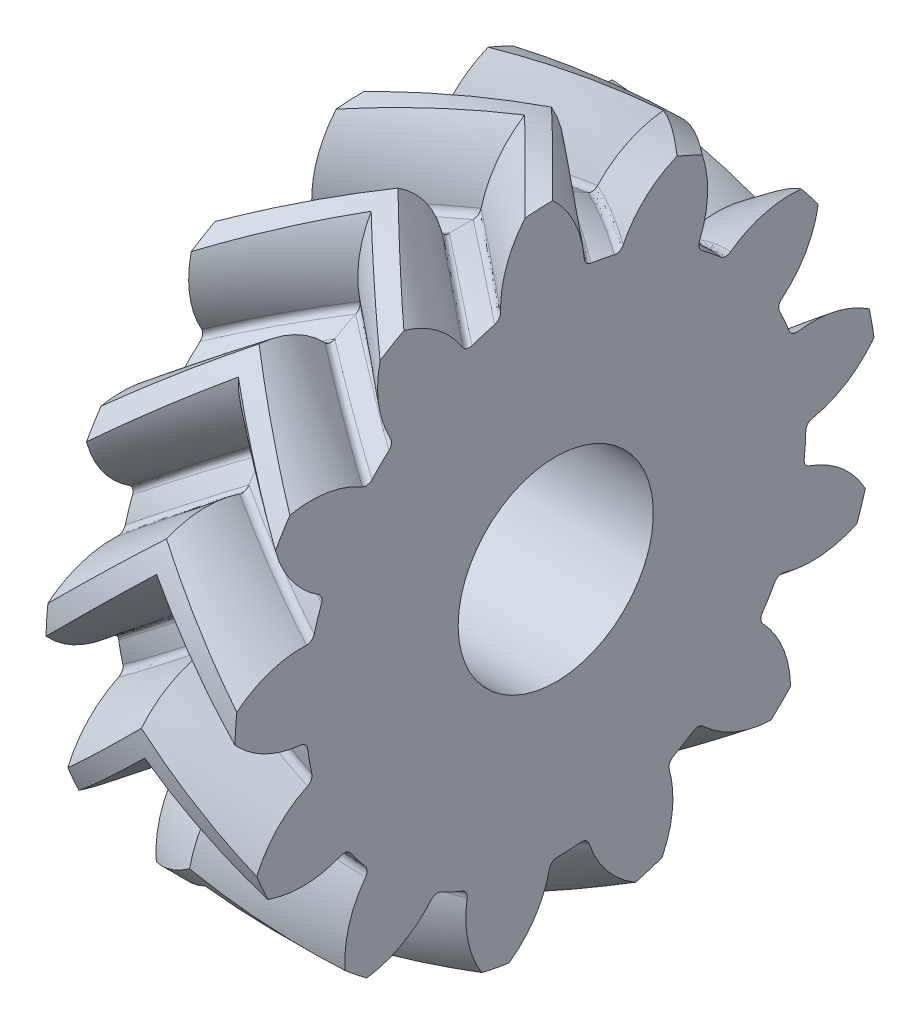
from build123d import *

# Parameters (mm, degrees)
BASPROSKE_W            = 3
BASPROSKE_H            = 10.192388155
TOOTHCUTRH_PITCH       = 64.040663503
TOOTHCUTRH_HEIGHT      = 3
TOOTHCUTRH_RADIUS      = 10.192388155
TOOTHCUTRH_START_ANGLE = -90
TEETHCUTSRH_COUNT      = 13
TEETHCUTSRH_ANGLE      = 332.307692308
BORSKE_R               = 3
BORE_DEPTH             = 62.5000025
SKETCH3_R              = 3.1
CUT_EXTRUDE1_DEPTH     = 16.613121343


with BuildPart() as part:
    # BasProSke → Base-Revolve (revolve)
    with BuildSketch(Plane(origin=(0, 0, 0), x_dir=(1, 0, 0), z_dir=(0, 1, 0)), mode=Mode.PRIVATE) as base_revolve_sk:
        with Locations((1.5, 5.096194078)):
            Rectangle(BASPROSKE_W, BASPROSKE_H)
    revolve(base_revolve_sk.sketch.rotate(Axis((-10, 0, 0), (1, 0, 0)), 180), axis=Axis((-10, 0, 0), (1, 0, 0)))

    # ToothCutRH: sweep along a helix
    with BuildLine() as toothcutrh_path:
        add(Helix(TOOTHCUTRH_PITCH, TOOTHCUTRH_HEIGHT, TOOTHCUTRH_RADIUS, center=(0, 0, 0), direction=(1, 0, 0), mode=Mode.PRIVATE).rotate(Axis((0, 0, 0), (1, 0, 0)), TOOTHCUTRH_START_ANGLE))
    # TooCutSkeRH → ToothCutRH (sweep, cut)
    with BuildSketch(Plane(origin=(0, 0, 0), x_dir=(0, 0, -1), z_dir=(1, 0, 0))):
        with BuildLine():
            ThreePointArc((0.375776511, 7.933493658), (0, 7.942388155), (-0.375776511, 7.933493658))
            ThreePointArc((-0.375776511, 7.933493658), (-0.535012481, 7.981023261), (-0.629656106, 8.117616603))
            ThreePointArc((-0.629656106, 8.117616603), (-1.291728477, 9.365875371), (-2.420945746, 10.215203419))
            ThreePointArc((-2.420945746, 10.215203419), (0, 10.4981598), (2.420945746, 10.215203419))
            ThreePointArc((2.420945746, 10.215203419), (1.291728477, 9.365875371), (0.629656106, 8.117616603))
            ThreePointArc((0.629656106, 8.117616603), (0.535012481, 7.981023261), (0.375776511, 7.933493658))
        make_face()
    toothcutrh = sweep(path=toothcutrh_path.line, is_frenet=True, mode=Mode.SUBTRACT)

    # TeethCutsRH: ToothCutRH ×13 about axis
    teethcutsrh_axis = Axis((-10, 0, 0), (1, 0, 0))
    for i in range(1, TEETHCUTSRH_COUNT):
        add(toothcutrh.rotate(teethcutsrh_axis, i * TEETHCUTSRH_ANGLE / (TEETHCUTSRH_COUNT - 1)), mode=Mode.SUBTRACT)

    # BorSke → Bore (cut, symmetric)
    with BuildSketch(Plane(origin=(0, 0, 0), x_dir=(0, 0, -1), z_dir=(1, 0, 0))):
        with Locations(Location((0, 0, 0), (0, 0, 180))):
            Circle(BORSKE_R)
    extrude(amount=BORE_DEPTH, both=True, mode=Mode.SUBTRACT)

    # Mirror1: part across plane


with BuildPart() as part_1:
    add(part.part)
    add(part.part.mirror(Plane(origin=(0, 0, 0), x_dir=(0, 0, 1), z_dir=(1, 0, 0))))

    # Sketch3 → Cut-Extrude1 (cut, through all)
    with BuildSketch(Plane.ZY.offset(3)):
        Circle(SKETCH3_R)
    extrude(amount=-CUT_EXTRUDE1_DEPTH, mode=Mode.SUBTRACT)


solid = part_1.part
